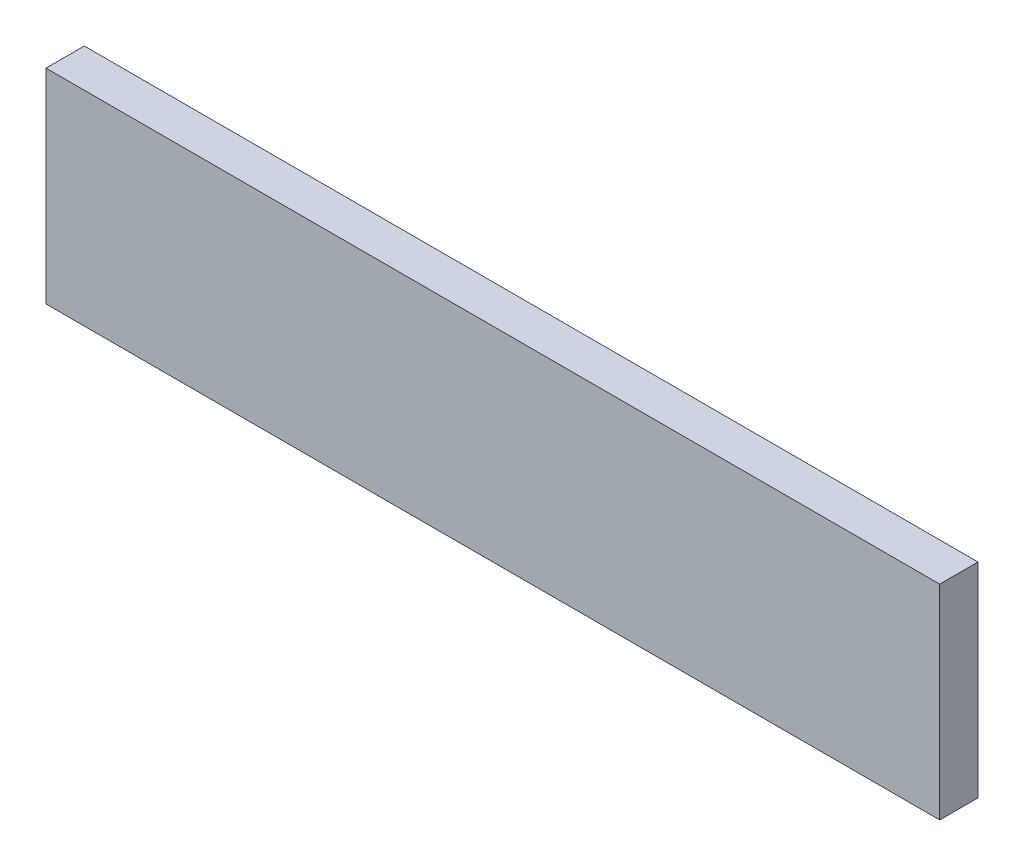
from build123d import *

# Parameters (mm, degrees)
IZIM1_W            = 350
IZIM1_H            = 80
TABAN_FLAN_1_DEPTH = 15


# Sheet-metal steps are written as plain solids
with BuildPart() as part:
    # Çizim1 → Taban-Flanş1 (new body)
    with BuildSketch(Plane.XY):
        with Locations((175, -40)):
            Rectangle(IZIM1_W, IZIM1_H)
    extrude(amount=-TABAN_FLAN_1_DEPTH)


solid = part.part
